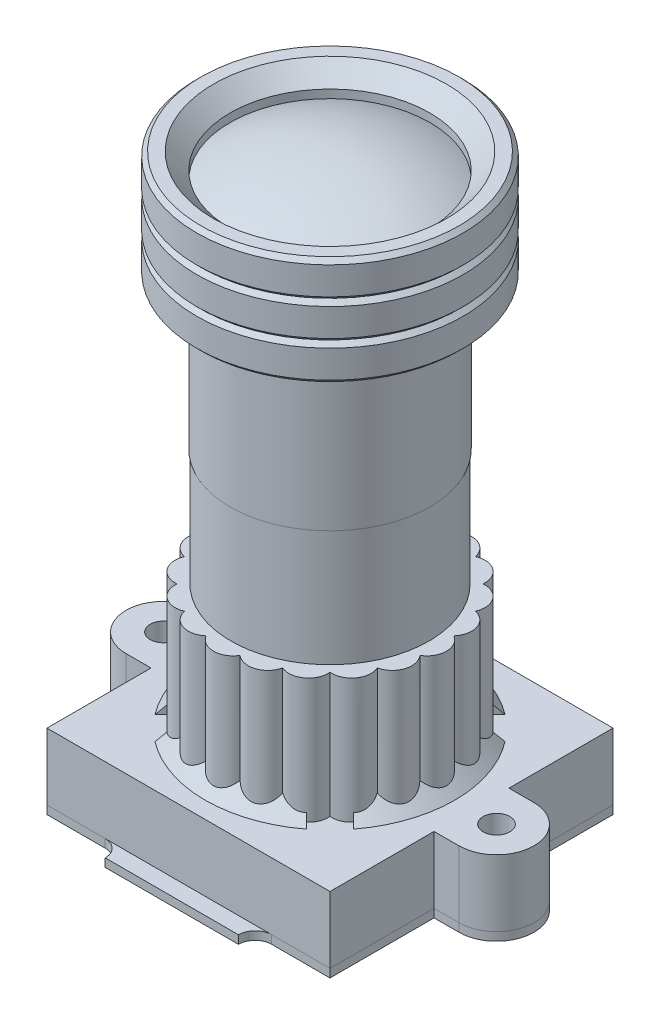
from build123d import *

# Parameters (mm, degrees)
SKETCH1_R           = 0.8000000000000008
SKETCH1_R_2         = 0.8000000000000013
BOSS_EXTRUDE1_DEPTH = 4
SKETCH2_R           = 0.8000000000000009
BOSS_EXTRUDE2_DEPTH = 0.5
FILLET1_R           = 1
CHAMFER1_SIZE       = 1
CUT_EXTRUDE1_REACH  = 35.769
BOSS_EXTRUDE3_START = -7.5
BOSS_EXTRUDE3_DEPTH = 7.5


# Read off the part's stored shape, not the designer's step: Boss-Extrude3, Intersect1
with BuildPart() as part:
    # Sketch1 → Boss-Extrude1 (new body)
    with BuildSketch(Plane(origin=(0, 0, 0), x_dir=(1, 0, 0), z_dir=(0, 1, 0))):
        with BuildLine():
            Line((-8.5, -8.5), (8.5, -8.5))
            Line((8.5, -8.5), (8.499999999999996, -2.2500000000000053))
            Line((8.499999999999996, -2.2500000000000053), (9.999999999999996, -2.250000000000006))
            ThreePointArc((9.999999999999996, -2.250000000000006), (12.24999999999999, 4.9e-15), (9.999999999999996, 2.249999999999995))
            Line((9.999999999999996, 2.249999999999995), (8.499999999999996, 2.2499999999999956))
            Line((8.499999999999996, 2.2499999999999956), (8.5, 8.5))
            Line((8.5, 8.5), (-8.5, 8.5))
            Line((-8.5, 8.5), (-8.5, 2.249999999999999))
            Line((-8.5, 2.249999999999999), (-10, 2.2499999999999996))
            ThreePointArc((-10, 2.2499999999999996), (-12.25, -9.5e-16), (-10, -2.2500000000000018))
            Line((-10, -2.2500000000000018), (-8.5, -2.2500000000000018))
            Line((-8.5, -2.2500000000000018), (-8.5, -8.5))
        make_face()
        with Locations(Location((-10, -1.22e-15, 0), (0, 0, 270))):
            Circle(SKETCH1_R, mode=Mode.SUBTRACT)
        with Locations(Location((10, 4.9e-15, 0), (0, 0, 90))):
            Circle(SKETCH1_R_2, mode=Mode.SUBTRACT)
    extrude(amount=-BOSS_EXTRUDE1_DEPTH)

    # Sketch3 → Revolve1 (revolve)
    with BuildSketch(Plane.XY, mode=Mode.PRIVATE) as revolve1_sk:
        with BuildLine():
            Line((0, 0), (0, 30))
            ThreePointArc((0, 30), (3.0923292192132457, 29.619316876852977), (6.000000000000001, 28.499999999999996))
            Line((6.000000000000001, 28.499999999999996), (6, 28.999999999999996))
            Line((6, 28.999999999999996), (7, 30))
            Line((7, 30), (8.000000000000002, 30))
            Line((8.000000000000002, 30), (8, 23.5))
            Line((8, 23.5), (7, 23.5))
            Line((7, 23.5), (5.999999999999999, 22.5))
            Line((5.999999999999999, 22.5), (5.999999999999999, 14.499999999999998))
            Line((5.999999999999999, 14.499999999999998), (5.95, 14.499999999999998))
            Line((5.95, 14.499999999999998), (5.95, 7.499999999999993))
            Line((5.95, 7.499999999999993), (6.499999999999999, 7.499999999999993))
            Line((6.499999999999999, 7.499999999999993), (6.5, 0))
            Line((6.5, 0), (0, 0))
        make_face()
    revolve(revolve1_sk.sketch.rotate(Axis((0, 0, 0), (0, 1, 0)), 90), axis=Axis((0, 0, 0), (0, 1, 0)))

    # Chamfer1
    chamfer1_edges = [part.edges().sort_by_distance(p)[0] for p in [
        (1.37e-15, 0, 6.5),
    ]]
    chamfer(chamfer1_edges, length=CHAMFER1_SIZE)

    # Cut-Extrude1: up to this face of the body (flat: up to its plane)
    cut_extrude1_end = Plane(part.part.faces().sort_by_distance((0, 7.5, 6.133847763))[0])
    # Sketch5 → Cut-Extrude1 (cut, up to the picked face)
    with BuildSketch(Plane(origin=(0, 0, 0), x_dir=(1, 0, 0), z_dir=(0, 1, 0)), mode=Mode.PRIVATE) as cut_extrude1_sk1:
        with BuildLine():
            ThreePointArc((-4.548842229220669, 5.9630557915936375), (-4.9371044232231265, 5.645794887718675), (-5.303300875225197, 5.303300842572986))
            ThreePointArc((-5.303300875225197, 5.303300842572986), (-5.6457949029174515, 4.937104405842659), (-5.963055791593638, 4.548842229220667))
            Line((-5.963055791593709, 4.548842229220613), (-5.248582312332756, 3.8343687499596593))
            ThreePointArc((-5.248582312332866, 3.834368749959578), (-4.596194077712615, 4.596194077712502), (-3.8343687499597072, 5.248582312332771))
            Line((-3.8343687499596966, 5.248582312332786), (-4.548842229220616, 5.963055791593706))
        make_face()
    cut_extrude1_tool1 = split(extrude(cut_extrude1_sk1.sketch, amount=CUT_EXTRUDE1_REACH, mode=Mode.PRIVATE), bisect_by=cut_extrude1_end, keep=Keep.BOTH, mode=Mode.PRIVATE)
    # Sketch5 → Cut-Extrude1 (cut, up to the picked face)
    with BuildSketch(Plane(origin=(0, 0, 0), x_dir=(1, 0, 0), z_dir=(0, 1, 0)), mode=Mode.PRIVATE) as cut_extrude1_sk2:
        with BuildLine():
            Line((5.963055791593703, -4.548842229220615), (5.2485823123327755, -3.8343687499596877))
            ThreePointArc((5.248582312332793, -3.834368749959676), (4.596194077712553, -4.596194077712564), (3.8343687499596646, -5.248582312332802))
            Line((3.8343687499596824, -5.2485823123327755), (4.54884222922061, -5.963055791593703))
            ThreePointArc((4.548842229220657, -5.9630557915936455), (4.937104416588315, -5.645794893520648), (5.303300862760566, -5.303300855037617))
            ThreePointArc((5.303300862760566, -5.303300855037617), (5.645794897115485, -4.937104412477463), (5.963055791593644, -4.54884222922066))
        make_face()
    cut_extrude1_tool2 = split(extrude(cut_extrude1_sk2.sketch, amount=CUT_EXTRUDE1_REACH, mode=Mode.PRIVATE), bisect_by=cut_extrude1_end, keep=Keep.BOTH, mode=Mode.PRIVATE)
    # Sketch5 → Cut-Extrude1 (cut, up to the picked face)
    with BuildSketch(Plane(origin=(0, 0, 0), x_dir=(1, 0, 0), z_dir=(0, 1, 0)), mode=Mode.PRIVATE) as cut_extrude1_sk3:
        with BuildLine():
            ThreePointArc((5.3033008588990755, 5.303300858899107), (4.937104414532878, 5.645794895318076), (4.548842229220653, 5.963055791593649))
            Line((4.548842229220598, 5.963055791593717), (3.834368749959668, 5.2485823123327835))
            ThreePointArc((3.8343687499596513, 5.248582312332813), (4.596194077712545, 4.596194077712571), (5.2485823123327915, 3.83436874995968))
            Line((5.248582312332767, 3.8343687499596983), (5.963055791593693, 4.54884222922063))
            ThreePointArc((5.9630557915936295, 4.5488422292206785), (5.645794895318051, 4.937104414532906), (5.3033008588990755, 5.303300858899107))
        make_face()
    cut_extrude1_tool3 = split(extrude(cut_extrude1_sk3.sketch, amount=CUT_EXTRUDE1_REACH, mode=Mode.PRIVATE), bisect_by=cut_extrude1_end, keep=Keep.BOTH, mode=Mode.PRIVATE)
    # Sketch5 → Cut-Extrude1 (cut, up to the picked face)
    with BuildSketch(Plane(origin=(0, 0, 0), x_dir=(1, 0, 0), z_dir=(0, 1, 0)), mode=Mode.PRIVATE) as cut_extrude1_sk4:
        with BuildLine():
            Line((-5.248582312332744, -3.834368749959675), (-5.963055791593696, -4.54884222922063))
            ThreePointArc((-5.963055791593628, -4.548842229220681), (-5.645794890621364, -4.937104419903775), (-5.303300848808972, -5.303300868989211))
            ThreePointArc((-5.303300848808972, -5.303300868989211), (-4.937104409162011, -5.645794900014764), (-4.548842229220654, -5.963055791593648))
            Line((-4.548842229220598, -5.963055791593718), (-3.8343687499596806, -5.248582312332798))
            ThreePointArc((-3.8343687499596952, -5.248582312332781), (-4.596194077712604, -4.5961940777125125), (-5.248582312332856, -3.8343687499595904))
        make_face()
    cut_extrude1_tool4 = split(extrude(cut_extrude1_sk4.sketch, amount=CUT_EXTRUDE1_REACH, mode=Mode.PRIVATE), bisect_by=cut_extrude1_end, keep=Keep.BOTH, mode=Mode.PRIVATE)
    # Sketch5 → Cut-Extrude1 (cut, up to the picked face)
    with BuildSketch(Plane(origin=(0, 0, 0), x_dir=(1, 0, 0), z_dir=(0, 1, 0)), mode=Mode.PRIVATE) as cut_extrude1_sk5:
        with BuildLine():
            ThreePointArc((-4.548842229220669, 5.9630557915936375), (-4.9371044232231265, 5.645794887718675), (-5.303300875225197, 5.303300842572986))
            ThreePointArc((-5.303300875225197, 5.303300842572986), (-5.6457949029174515, 4.937104405842659), (-5.963055791593638, 4.548842229220667))
            Line((-5.963055791593709, 4.548842229220613), (-5.248582312332756, 3.8343687499596593))
            ThreePointArc((-5.248582312332866, 3.834368749959578), (-4.596194077712615, 4.596194077712502), (-3.8343687499597072, 5.248582312332771))
            Line((-3.8343687499596966, 5.248582312332786), (-4.548842229220616, 5.963055791593706))
        make_face()
    cut_extrude1_tool5 = split(extrude(cut_extrude1_sk5.sketch, amount=CUT_EXTRUDE1_REACH, mode=Mode.PRIVATE), bisect_by=cut_extrude1_end, keep=Keep.BOTH, mode=Mode.PRIVATE)
    # Sketch5 → Cut-Extrude1 (cut, up to the picked face)
    with BuildSketch(Plane(origin=(0, 0, 0), x_dir=(1, 0, 0), z_dir=(0, 1, 0)), mode=Mode.PRIVATE) as cut_extrude1_sk6:
        with BuildLine():
            Line((5.963055791593703, -4.548842229220615), (5.2485823123327755, -3.8343687499596877))
            ThreePointArc((5.248582312332793, -3.834368749959676), (4.596194077712553, -4.596194077712564), (3.8343687499596646, -5.248582312332802))
            Line((3.8343687499596824, -5.2485823123327755), (4.54884222922061, -5.963055791593703))
            ThreePointArc((4.548842229220657, -5.9630557915936455), (4.937104416588315, -5.645794893520648), (5.303300862760566, -5.303300855037617))
            ThreePointArc((5.303300862760566, -5.303300855037617), (5.645794897115485, -4.937104412477463), (5.963055791593644, -4.54884222922066))
        make_face()
    cut_extrude1_tool6 = split(extrude(cut_extrude1_sk6.sketch, amount=CUT_EXTRUDE1_REACH, mode=Mode.PRIVATE), bisect_by=cut_extrude1_end, keep=Keep.BOTH, mode=Mode.PRIVATE)
    # Sketch5 → Cut-Extrude1 (cut, up to the picked face)
    with BuildSketch(Plane(origin=(0, 0, 0), x_dir=(1, 0, 0), z_dir=(0, 1, 0)), mode=Mode.PRIVATE) as cut_extrude1_sk7:
        with BuildLine():
            ThreePointArc((5.3033008588990755, 5.303300858899107), (4.937104414532878, 5.645794895318076), (4.548842229220653, 5.963055791593649))
            Line((4.548842229220598, 5.963055791593717), (3.834368749959668, 5.2485823123327835))
            ThreePointArc((3.8343687499596513, 5.248582312332813), (4.596194077712545, 4.596194077712571), (5.2485823123327915, 3.83436874995968))
            Line((5.248582312332767, 3.8343687499596983), (5.963055791593693, 4.54884222922063))
            ThreePointArc((5.9630557915936295, 4.5488422292206785), (5.645794895318051, 4.937104414532906), (5.3033008588990755, 5.303300858899107))
        make_face()
    cut_extrude1_tool7 = split(extrude(cut_extrude1_sk7.sketch, amount=CUT_EXTRUDE1_REACH, mode=Mode.PRIVATE), bisect_by=cut_extrude1_end, keep=Keep.BOTH, mode=Mode.PRIVATE)
    # Sketch5 → Cut-Extrude1 (cut, up to the picked face)
    with BuildSketch(Plane(origin=(0, 0, 0), x_dir=(1, 0, 0), z_dir=(0, 1, 0)), mode=Mode.PRIVATE) as cut_extrude1_sk8:
        with BuildLine():
            Line((-5.248582312332744, -3.834368749959675), (-5.963055791593696, -4.54884222922063))
            ThreePointArc((-5.963055791593628, -4.548842229220681), (-5.645794890621364, -4.937104419903775), (-5.303300848808972, -5.303300868989211))
            ThreePointArc((-5.303300848808972, -5.303300868989211), (-4.937104409162011, -5.645794900014764), (-4.548842229220654, -5.963055791593648))
            Line((-4.548842229220598, -5.963055791593718), (-3.8343687499596806, -5.248582312332798))
            ThreePointArc((-3.8343687499596952, -5.248582312332781), (-4.596194077712604, -4.5961940777125125), (-5.248582312332856, -3.8343687499595904))
        make_face()
    cut_extrude1_tool8 = split(extrude(cut_extrude1_sk8.sketch, amount=CUT_EXTRUDE1_REACH, mode=Mode.PRIVATE), bisect_by=cut_extrude1_end, keep=Keep.BOTH, mode=Mode.PRIVATE)
    add(cut_extrude1_tool1.solids().sort_by(Axis((-4.932725, 0, -4.932725), (0, 1, 0)))[0], mode=Mode.SUBTRACT)
    add(cut_extrude1_tool2.solids().sort_by(Axis((4.932725, 0, 4.932725), (0, 1, 0)))[0], mode=Mode.SUBTRACT)
    add(cut_extrude1_tool3.solids().sort_by(Axis((4.932725, 0, -4.932725), (0, 1, 0)))[0], mode=Mode.SUBTRACT)
    add(cut_extrude1_tool4.solids().sort_by(Axis((-4.932725, 0, 4.932725), (0, 1, 0)))[0], mode=Mode.SUBTRACT)
    add(cut_extrude1_tool5.solids().sort_by(Axis((-4.932725, 0, -4.932725), (0, 1, 0)))[0], mode=Mode.SUBTRACT)
    add(cut_extrude1_tool6.solids().sort_by(Axis((4.932725, 0, 4.932725), (0, 1, 0)))[0], mode=Mode.SUBTRACT)
    add(cut_extrude1_tool7.solids().sort_by(Axis((4.932725, 0, -4.932725), (0, 1, 0)))[0], mode=Mode.SUBTRACT)
    add(cut_extrude1_tool8.solids().sort_by(Axis((-4.932725, 0, 4.932725), (0, 1, 0)))[0], mode=Mode.SUBTRACT)

    # Boss-Extrude3 outline → Boss-Extrude3 (add)
    with BuildSketch(Plane(origin=(0, 7.499999999999993, 0), x_dir=(1, 0, 0), z_dir=(0, 1, 0)).offset(BOSS_EXTRUDE3_START)):
        with BuildLine():
            ThreePointArc((1.016824021, 6.419974214), (2.008610462, 6.181867356), (2.950938247, 5.791542408))
            ThreePointArc((2.950938247, 5.791542408), (2.163118954, 6.657395616), (1.016824021, 6.419974214))
        make_face()
        with BuildLine():
            ThreePointArc((2.950938247, 5.791542408), (3.820604139, 5.258610464), (4.596194078, 4.596194078))
            ThreePointArc((4.596194078, 4.596194078), (4.114496756, 5.663118968), (2.950938247, 5.791542408))
        make_face()
        with BuildLine():
            ThreePointArc((-1.016824021, 6.419974214), (0, 6.5), (1.016824021, 6.419974214))
            ThreePointArc((1.016824021, 6.419974214), (0, 7), (-1.016824021, 6.419974214))
        make_face()
        with BuildLine():
            ThreePointArc((-2.95093826, 5.791542401), (-2.008610469, 6.181867354), (-1.016824021, 6.419974214))
            ThreePointArc((-1.016824021, 6.419974214), (-2.163118955, 6.657395616), (-2.95093826, 5.791542401))
        make_face()
        with BuildLine():
            ThreePointArc((4.596194078, 4.596194078), (5.25861046, 3.820604145), (5.791542401, 2.95093826))
            ThreePointArc((5.791542401, 2.95093826), (5.663118962, 4.114496764), (4.596194078, 4.596194078))
        make_face()
        with BuildLine():
            ThreePointArc((-2.950938244, 5.791542405), (-4.114496764, 5.663118962), (-4.596194078, 4.596194078))
            ThreePointArc((-4.596194078, 4.596194078), (-3.820604145, 5.25861046), (-2.950938244, 5.791542405))
        make_face()
        with BuildLine():
            ThreePointArc((6.419974179, 1.016823984), (6.657395616, 2.163118956), (5.791542366, 2.950938257))
            ThreePointArc((5.791542366, 2.950938257), (6.181867354, 2.008610469), (6.419974179, 1.016823984))
        make_face()
        with BuildLine():
            ThreePointArc((-4.596194078, 4.596194078), (-5.663118968, 4.114496756), (-5.791542397, 2.950938224))
            ThreePointArc((-5.791542397, 2.950938224), (-5.258610464, 3.820604139), (-4.596194078, 4.596194078))
        make_face()
        with BuildLine():
            ThreePointArc((6.419974174, -1.016824047), (7, 0), (6.419974173, 1.016824047))
            ThreePointArc((6.419974173, 1.016824047), (6.5, 0), (6.419974174, -1.016824047))
        make_face()
        with BuildLine():
            ThreePointArc((5.791542367, -2.950938257), (6.657395616, -2.163118955), (6.419974179, -1.016823983))
            ThreePointArc((6.419974179, -1.016823983), (6.181867356, -2.008610462), (5.791542367, -2.950938257))
        make_face()
        with BuildLine():
            ThreePointArc((-6.419974214, 1.016824021), (-6.181867356, 2.008610462), (-5.791542408, 2.950938247))
            ThreePointArc((-5.791542408, 2.950938247), (-6.657395616, 2.163118955), (-6.419974214, 1.016824021))
        make_face()
        with BuildLine():
            ThreePointArc((5.791542408, -2.950938247), (5.258610464, -3.820604139), (4.596194078, -4.596194078))
            ThreePointArc((4.596194078, -4.596194078), (5.663118968, -4.114496756), (5.791542408, -2.950938247))
        make_face()
        with BuildLine():
            ThreePointArc((-6.419974214, -1.016824022), (-6.5, 0), (-6.419974214, 1.016824021))
            ThreePointArc((-6.419974214, 1.016824021), (-7, 0), (-6.419974214, -1.016824022))
        make_face()
        with BuildLine():
            ThreePointArc((-5.791542401, -2.95093826), (-6.181867354, -2.008610469), (-6.419974214, -1.016824022))
            ThreePointArc((-6.419974214, -1.016824022), (-6.657395616, -2.163118956), (-5.791542401, -2.95093826))
        make_face()
        with BuildLine():
            ThreePointArc((4.596194078, -4.596194078), (3.820604145, -5.25861046), (2.95093826, -5.791542401))
            ThreePointArc((2.95093826, -5.791542401), (4.114496764, -5.663118962), (4.596194078, -4.596194078))
        make_face()
        with BuildLine():
            ThreePointArc((-5.791542405, -2.950938244), (-5.663118962, -4.114496764), (-4.596194078, -4.596194078))
            ThreePointArc((-4.596194078, -4.596194078), (-5.25861046, -3.820604145), (-5.791542405, -2.950938244))
        make_face()
        with BuildLine():
            ThreePointArc((1.016823982, -6.419974178), (2.163118955, -6.657395616), (2.950938257, -5.791542366))
            ThreePointArc((2.950938257, -5.791542366), (2.008610469, -6.181867354), (1.016823982, -6.419974178))
        make_face()
        with BuildLine():
            ThreePointArc((-4.596194078, -4.596194078), (-4.114496756, -5.663118968), (-2.950938224, -5.791542397))
            ThreePointArc((-2.950938224, -5.791542397), (-3.820604139, -5.258610464), (-4.596194078, -4.596194078))
        make_face()
        with BuildLine():
            ThreePointArc((-1.016824047, -6.419974174), (0, -7), (1.016824047, -6.419974173))
            ThreePointArc((1.016824047, -6.419974173), (0, -6.5), (-1.016824047, -6.419974174))
        make_face()
        with BuildLine():
            ThreePointArc((-2.950938257, -5.791542367), (-2.163118954, -6.657395616), (-1.016823982, -6.419974178))
            ThreePointArc((-1.016823982, -6.419974178), (-2.008610462, -6.181867356), (-2.950938257, -5.791542367))
        make_face()
    extrude(amount=BOSS_EXTRUDE3_DEPTH)

    # Sketch6 → Cut-Revolve1 (revolve, cut)
    with BuildSketch(Plane.XY, mode=Mode.PRIVATE) as cut_revolve1_sk:
        Polygon((7.7500000000000036, 30), (8, 29.750000000000004), (8.000000000000002, 30), align=None)
        Polygon((8, 28.083333333333332), (8, 27.583333333333332), (7.7500000000000036, 27.833333333333336), align=None)
        Polygon((8, 23.749999999999996), (8.000000000000002, 23.5), (7.7500000000000036, 23.5), align=None)
        Polygon((8, 25.416666666666668), (8, 25.916666666666668), (7.7500000000000036, 25.666666666666664), align=None)
    revolve(cut_revolve1_sk.sketch.rotate(Axis((0, 30, 0), (0, 1, 0)), 90), axis=Axis((0, 30, 0), (0, 1, 0)), mode=Mode.SUBTRACT)


with BuildPart() as body_2:
    # Sketch2 → Boss-Extrude2 (new body)
    with BuildSketch(Plane.XZ.offset(4)):
        with BuildLine():
            Line((-4, 8.500000000000002), (-3.9999999999999982, 9.500000000000004))
            Line((-3.9999999999999982, 9.500000000000004), (4.000000000000002, 9.500000000000005))
            Line((4.000000000000002, 9.500000000000005), (4, 8.500000000000004))
            Line((4, 8.500000000000004), (8.5, 8.5))
            Line((8.5, 8.5), (8.499999999999996, 2.2500000000000053))
            Line((8.499999999999996, 2.2500000000000053), (9.999999999999996, 2.2500000000000013))
            ThreePointArc((9.999999999999996, 2.2500000000000013), (12.25, -4.9e-15), (9.999999999999996, -2.2500000000000053))
            Line((9.999999999999996, -2.2500000000000053), (8.499999999999996, -2.2499999999999956))
            Line((8.499999999999996, -2.2499999999999956), (8.5, -8.5))
            Line((8.5, -8.5), (-8.5, -8.5))
            Line((-8.5, -8.5), (-8.5, -2.249999999999999))
            Line((-8.5, -2.249999999999999), (-10, -2.2499999999999996))
            ThreePointArc((-10, -2.2499999999999996), (-12.25, 1.5e-15), (-10, 2.2500000000000018))
            Line((-10, 2.2500000000000018), (-8.5, 2.2500000000000018))
            Line((-8.5, 2.2500000000000018), (-8.5, 8.5))
            Line((-8.5, 8.5), (-4, 8.500000000000002))
        make_face()
        with Locations(Location((10, -4.9e-15, 0), (0, 0, 270))):
            Circle(SKETCH2_R, mode=Mode.SUBTRACT)
        with Locations(Location((-10, 1.22e-15, 0), (0, 0, 270))):
            Circle(SKETCH2_R, mode=Mode.SUBTRACT)
    extrude(amount=BOSS_EXTRUDE2_DEPTH)

    # Fillet1
    fillet1_edges = [body_2.edges().sort_by_distance(p)[0] for p in [
        (-4, -4.25, 8.500000000000002),
        (4, -4.25, 8.500000000000004),
    ]]
    fillet(fillet1_edges, radius=FILLET1_R - 0.0001)  # a hair under: the kernel refuses the full size


with BuildPart() as body_3:
    # Intersect1: the piece on the far side of the plane
    add(part.part)
    split(bisect_by=Plane(origin=(0, 7.5, 0), x_dir=(1, 0, 0), z_dir=(0, 1, 0)), keep=Keep.BOTTOM)


with BuildPart() as part_1:
    add(part.part)

    # Intersect1
    split(bisect_by=Plane(origin=(0, 7.5, 0), x_dir=(1, 0, 0), z_dir=(0, 1, 0)), keep=Keep.TOP)


solid = Compound([body_2.part, body_3.part, part_1.part])
